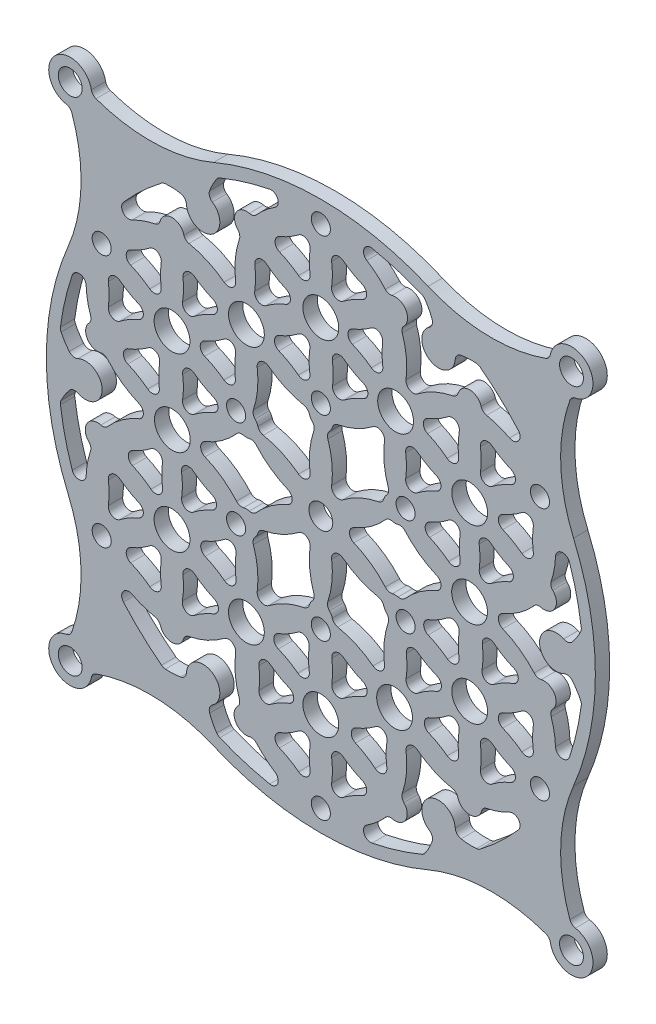
from build123d import *

# Parameters (mm, degrees)
ESBO_O1_W                = 120
ESBO_O1_H                = 120
RESSALTO_EXTRUS_O1_DEPTH = 3
ESBO_O2_R                = 2.5
CORTE_EXTRUS_O1_DEPTH    = 85.905830189
ESBO_O3_W                = 120
ESBO_O3_H                = 120
ESBO_O3_R                = 2.5
ESBO_O3_R_2              = 3.75
CORTE_EXTRUS_O2_DEPTH    = 85.905830189
ESBO_O4_R                = 2
CORTE_EXTRUS_O3_DEPTH    = 10


with BuildPart() as part:
    # Esboço1 → Ressalto-extrusão1 (new body)
    with BuildSketch(Plane.XY):
        Rectangle(ESBO_O1_W, ESBO_O1_H)
    extrude(amount=RESSALTO_EXTRUS_O1_DEPTH)

    # Esboço2 → Corte-extrusão1 (cut, through all)
    with BuildSketch(Plane.XY.offset(3)):
        with Locations((-52.5, 52.5)):
            Circle(ESBO_O2_R)
        with Locations((52.5, 52.5)):
            Circle(ESBO_O2_R)
        with Locations((52.5, -52.5)):
            Circle(ESBO_O2_R)
        with Locations((-52.5, -52.5)):
            Circle(ESBO_O2_R)
    extrude(amount=-CORTE_EXTRUS_O1_DEPTH, mode=Mode.SUBTRACT)

    # Esboço3 → Corte-extrusão2 (cut, through all)
    # profile 1 of 62: a face of its own
    with BuildSketch(Plane.XY.offset(3)):
        Rectangle(ESBO_O3_W, ESBO_O3_H)
        with BuildLine():
            ThreePointArc((52.926828817, 22.472222662), (57.5, 0), (52.926828817, -22.472222662))
            ThreePointArc((52.926828817, -22.472222662), (50.238285109, -34.713933242), (52.16675505, -47.098146938))
            ThreePointArc((52.16675505, -47.098146938), (52.6077104, -47.739558715), (53.310735171, -48.073634845))
            ThreePointArc((53.310735171, -48.073634845), (55.681980515, -55.681980515), (48.073634845, -53.310735171))
            ThreePointArc((48.073634845, -53.310735171), (47.739558715, -52.6077104), (47.098146938, -52.16675505))
            ThreePointArc((47.098146938, -52.16675505), (34.713933242, -50.238285109), (22.472222662, -52.926828817))
            ThreePointArc((22.472222662, -52.926828817), (0, -57.5), (-22.472222662, -52.926828817))
            ThreePointArc((-22.472222662, -52.926828817), (-34.713933242, -50.238285109), (-47.098146938, -52.16675505))
            ThreePointArc((-47.098146938, -52.16675505), (-47.739558715, -52.6077104), (-48.073634845, -53.310735171))
            ThreePointArc((-48.073634845, -53.310735171), (-55.681980515, -55.681980515), (-53.310735171, -48.073634845))
            ThreePointArc((-53.310735171, -48.073634845), (-52.6077104, -47.739558715), (-52.16675505, -47.098146938))
            ThreePointArc((-52.16675505, -47.098146938), (-50.238285109, -34.713933242), (-52.926828817, -22.472222662))
            ThreePointArc((-52.926828817, -22.472222662), (-57.5, 0), (-52.926828817, 22.472222662))
            ThreePointArc((-52.926828817, 22.472222662), (-50.238285109, 34.713933242), (-52.16675505, 47.098146938))
            ThreePointArc((-52.16675505, 47.098146938), (-52.6077104, 47.739558715), (-53.310735171, 48.073634845))
            ThreePointArc((-53.310735171, 48.073634845), (-55.681980515, 55.681980515), (-48.073634845, 53.310735171))
            ThreePointArc((-48.073634845, 53.310735171), (-47.739558715, 52.6077104), (-47.098146938, 52.16675505))
            ThreePointArc((-47.098146938, 52.16675505), (-34.713933242, 50.238285109), (-22.472222662, 52.926828817))
            ThreePointArc((-22.472222662, 52.926828817), (0, 57.5), (22.472222662, 52.926828817))
            ThreePointArc((22.472222662, 52.926828817), (34.713933242, 50.238285109), (47.098146938, 52.16675505))
            ThreePointArc((47.098146938, 52.16675505), (47.739558715, 52.6077104), (48.073634845, 53.310735171))
            ThreePointArc((48.073634845, 53.310735171), (55.681980515, 55.681980515), (53.310735171, 48.073634845))
            ThreePointArc((53.310735171, 48.073634845), (52.6077104, 47.739558715), (52.16675505, 47.098146938))
            ThreePointArc((52.16675505, 47.098146938), (50.238285109, 34.713933242), (52.926828817, 22.472222662))
        make_face(mode=Mode.SUBTRACT)
    # profile 2 of 62: a face of its own
    with BuildSketch(Plane.XY.offset(3)):
        Circle(ESBO_O3_R)
    # profile 3 of 62: a face of its own
    with BuildSketch(Plane.XY.offset(3)):
        with BuildLine():
            ThreePointArc((2.400354122, 17.301215278), (2.165063509, 16.75), (1.805342382, 16.270624713))
            ThreePointArc((1.805342382, 16.270624713), (1.424466196, 15.559289323), (1.467239729, 14.753538038))
            ThreePointArc((1.467239729, 14.753538038), (2.324697126, 10.766040666), (2.262426364, 6.68786818))
            ThreePointArc((2.262426364, 6.68786818), (3, 5.196152423), (4.660650559, 5.303252795))
            ThreePointArc((4.660650559, 5.303252795), (8.161316152, 7.396267101), (12.043318872, 8.647435897))
            ThreePointArc((12.043318872, 8.647435897), (12.76250672, 9.013268574), (13.188103146, 9.698784722))
            ThreePointArc((13.188103146, 9.698784722), (13.423393759, 10.25), (13.783114886, 10.729375287))
            ThreePointArc((13.783114886, 10.729375287), (14.163991072, 11.440710678), (14.121217539, 12.246461962))
            ThreePointArc((14.121217539, 12.246461962), (13.263760142, 16.233959334), (13.326030904, 20.31213182))
            ThreePointArc((13.326030904, 20.31213182), (12.588457268, 21.803847577), (10.927806709, 21.696747205))
            ThreePointArc((10.927806709, 21.696747205), (7.427141116, 19.603732899), (3.545138396, 18.352564103))
            ThreePointArc((3.545138396, 18.352564103), (2.825950548, 17.986731427), (2.400354122, 17.301215278))
        make_face()
    # profile 4 of 62: a face of its own
    with BuildSketch(Plane.XY.offset(3)):
        with BuildLine():
            ThreePointArc((9.633487233, -51.205128205), (9.043577777, -53.029345679), (10.728883756, -53.943406023))
            ThreePointArc((10.728883756, -53.943406023), (16.030662641, -52.611955441), (21.174087089, -50.76079231))
            ThreePointArc((21.174087089, -50.76079231), (21.547627608, -50.536393827), (21.840907819, -50.214099062))
            ThreePointArc((21.840907819, -50.214099062), (22.649446887, -48.847767429), (23.293856244, -47.396790469))
            ThreePointArc((23.293856244, -47.396790469), (23.317183811, -46.407389134), (22.719186733, -45.618808972))
            ThreePointArc((22.719186733, -45.618808972), (22.900415707, -39.673479264), (28.146896296, -42.47601931))
            ThreePointArc((28.146896296, -42.47601931), (28.525843263, -43.379148452), (29.381390361, -43.855889697))
            ThreePointArc((29.381390361, -43.855889697), (30.983933174, -44.03593585), (32.596352323, -44.01015656))
            ThreePointArc((32.596352323, -44.01015656), (33.013599121, -43.915526886), (33.387158074, -43.706952259))
            ThreePointArc((33.387158074, -43.706952259), (37.554424243, -40.182897105), (41.351918104, -36.263188899))
            ThreePointArc((41.351918104, -36.263188899), (41.402971616, -34.346640935), (39.528198213, -33.945408773))
            ThreePointArc((39.528198213, -33.945408773), (37.185694663, -34.967455949), (34.722052932, -35.647435897))
            ThreePointArc((34.722052932, -35.647435897), (34.05606544, -35.993062969), (33.675990789, -36.640010163))
            ThreePointArc((33.675990789, -36.640010163), (31.176914536, -38.579727723), (28.677838283, -36.640010163))
            ThreePointArc((28.677838283, -36.640010163), (28.297763632, -35.993062969), (27.63177614, -35.647435897))
            ThreePointArc((27.63177614, -35.647435897), (23.74977342, -34.396267101), (20.249107827, -32.303252795))
            ThreePointArc((20.249107827, -32.303252795), (18.588457268, -32.196152423), (17.850883632, -33.68786818))
            ThreePointArc((17.850883632, -33.68786818), (17.913154395, -37.766040666), (17.055696997, -41.753538038))
            ThreePointArc((17.055696997, -41.753538038), (17.012923464, -42.559289322), (17.39379965, -43.270624713))
            ThreePointArc((17.39379965, -43.270624713), (17.753520778, -46.25), (14.993445528, -47.428160009))
            ThreePointArc((14.993445528, -47.428160009), (14.186972916, -47.453979251), (13.510558601, -47.893897859))
            ThreePointArc((13.510558601, -47.893897859), (11.689857826, -49.68748421), (9.633487233, -51.205128205))
        make_face()
    # profile 5 of 62: a face of its own
    with BuildSketch(Plane.XY.offset(3)):
        with Locations((0, 36)):
            Circle(ESBO_O3_R_2)
    # profile 6 of 62: a face of its own
    with BuildSketch(Plane.XY.offset(3)):
        with BuildLine():
            ThreePointArc((21.815737444, 50.234347462), (21.525162343, 50.548378952), (21.157751941, 50.767603182))
            ThreePointArc((21.157751941, 50.767603182), (16.022197569, 52.614533972), (10.728883756, 53.943406023))
            ThreePointArc((10.728883756, 53.943406023), (9.043577777, 53.029345679), (9.633487233, 51.205128205))
            ThreePointArc((9.633487233, 51.205128205), (11.689857826, 49.68748421), (13.510558601, 47.893897859))
            ThreePointArc((13.510558601, 47.893897859), (14.142874171, 47.489949309), (14.893184201, 47.484268602))
            ThreePointArc((14.893184201, 47.484268602), (17.822567011, 46.289863862), (17.392260454, 43.15574156))
            ThreePointArc((17.392260454, 43.15574156), (17.022025075, 42.50311366), (17.055696997, 41.753538038))
            ThreePointArc((17.055696997, 41.753538038), (17.913154395, 37.766040666), (17.850883632, 33.68786818))
            ThreePointArc((17.850883632, 33.68786818), (18.588457268, 32.196152423), (20.249107827, 32.303252795))
            ThreePointArc((20.249107827, 32.303252795), (23.74977342, 34.396267101), (27.63177614, 35.647435897))
            ThreePointArc((27.63177614, 35.647435897), (28.350963988, 36.013268573), (28.776560414, 36.698784722))
            ThreePointArc((28.776560414, 36.698784722), (31.176914536, 38.5), (33.577268658, 36.698784722))
            ThreePointArc((33.577268658, 36.698784722), (34.002865084, 36.013268573), (34.722052932, 35.647435897))
            ThreePointArc((34.722052932, 35.647435897), (37.185694663, 34.967455949), (39.528198213, 33.945408773))
            ThreePointArc((39.528198213, 33.945408773), (41.402971616, 34.346640935), (41.351918104, 36.263188899))
            ThreePointArc((41.351918104, 36.263188899), (37.547958634, 40.188938807), (33.373092112, 43.717693476))
            ThreePointArc((33.373092112, 43.717693476), (32.991987066, 43.928989813), (32.566231506, 44.021830544))
            ThreePointArc((32.566231506, 44.021830544), (30.978684068, 44.0388801), (29.399896482, 43.871466494))
            ThreePointArc((29.399896482, 43.871466494), (28.531386008, 43.396968092), (28.147454094, 42.48479735))
            ThreePointArc((28.147454094, 42.48479735), (22.908033046, 39.669081391), (22.711863626, 45.613936885))
            ThreePointArc((22.711863626, 45.613936885), (23.304522923, 46.393679156), (23.289619403, 47.3729753))
            ThreePointArc((23.289619403, 47.3729753), (22.644272538, 48.850841163), (21.815737444, 50.234347462))
        make_face()
    # profile 7 of 62: a face of its own
    with BuildSketch(Plane.XY.offset(3)):
        with BuildLine():
            ThreePointArc((54.412089767, 6.224190903), (54.538761464, 6.632852067), (54.544910015, 7.060650923))
            ThreePointArc((54.544910015, 7.060650923), (53.576621812, 12.431636866), (52.080801861, 17.680217124))
            ThreePointArc((52.080801861, 17.680217124), (50.446549392, 18.682704744), (49.161685446, 17.259719432))
            ThreePointArc((49.161685446, 17.259719432), (48.875552489, 14.720028261), (48.232611533, 12.246461962))
            ThreePointArc((48.232611533, 12.246461962), (48.198939611, 11.49688634), (48.56917499, 10.84425844))
            ThreePointArc((48.56917499, 10.84425844), (48.999481547, 7.710136138), (46.070098738, 6.515731398))
            ThreePointArc((46.070098738, 6.515731398), (45.319788707, 6.510050691), (44.687473137, 6.106102141))
            ThreePointArc((44.687473137, 6.106102141), (41.662927815, 3.369773566), (38.099991459, 1.384615385))
            ThreePointArc((38.099991459, 1.384615385), (37.176914536, 0), (38.099991459, -1.384615385))
            ThreePointArc((38.099991459, -1.384615385), (41.662927815, -3.369773566), (44.687473137, -6.106102141))
            ThreePointArc((44.687473137, -6.106102141), (45.363887452, -6.546020749), (46.170360064, -6.571839991))
            ThreePointArc((46.170360064, -6.571839991), (48.930435314, -7.75), (48.570714187, -10.729375287))
            ThreePointArc((48.570714187, -10.729375287), (48.189838, -11.440710678), (48.232611533, -12.246461962))
            ThreePointArc((48.232611533, -12.246461962), (48.875552489, -14.720028261), (49.161685446, -17.259719432))
            ThreePointArc((49.161685446, -17.259719432), (50.446549392, -18.682704744), (52.080801861, -17.680217124))
            ThreePointArc((52.080801861, -17.680217124), (53.578621275, -12.423016634), (54.547179201, -7.043098834))
            ThreePointArc((54.547179201, -7.043098834), (54.539614674, -6.607404014), (54.407139325, -6.192268518))
            ThreePointArc((54.407139325, -6.192268518), (53.628130955, -4.808887328), (52.693752726, -3.525323975))
            ThreePointArc((52.693752726, -3.525323975), (51.848569819, -3.010421042), (50.866640827, -3.134011622))
            ThreePointArc((50.866640827, -3.134011622), (45.808448752, -0.004397873), (50.858759922, 3.137917575))
            ThreePointArc((50.858759922, 3.137917575), (51.830366186, 3.014530704), (52.671009764, 3.517085603))
            ThreePointArc((52.671009764, 3.517085603), (53.628205712, 4.814905313), (54.412089767, 6.224190903))
        make_face()
    # profile 8 of 62: a face of its own
    with BuildSketch(Plane.XY.offset(3)):
        with BuildLine():
            ThreePointArc((-2.262426305, 47.312135075), (-2.999999788, 48.803851036), (-4.660650466, 48.696750731))
            ThreePointArc((-4.660650466, 48.696750731), (-6.591521706, 47.409503238), (-8.671746356, 46.380943439))
            ThreePointArc((-8.671746356, 46.380943439), (-9.594822931, 44.995305167), (-8.669857412, 43.610927121))
            ThreePointArc((-8.669857412, 43.610927121), (-6.590050135, 42.58597826), (-4.659251221, 41.302181534))
            ThreePointArc((-4.659251221, 41.302181534), (-2.999237772, 41.196589212), (-2.262426305, 42.687864925))
            ThreePointArc((-2.262426305, 42.687864925), (-2.411543095, 45), (-2.262426305, 47.312135075))
        make_face()
    # profile 9 of 62: a face of its own
    with BuildSketch(Plane.XY.offset(3)):
        with BuildLine():
            ThreePointArc((-4.660650559, 5.303252795), (-3, 5.196152423), (-2.262426364, 6.68786818))
            ThreePointArc((-2.262426364, 6.68786818), (-2.324697126, 10.766040666), (-1.467239729, 14.753538038))
            ThreePointArc((-1.467239729, 14.753538038), (-1.424466196, 15.559289323), (-1.805342382, 16.270624713))
            ThreePointArc((-1.805342382, 16.270624713), (-2.165063509, 16.75), (-2.400354122, 17.301215278))
            ThreePointArc((-2.400354122, 17.301215278), (-2.825950548, 17.986731427), (-3.545138396, 18.352564103))
            ThreePointArc((-3.545138396, 18.352564103), (-7.427141116, 19.603732899), (-10.927806709, 21.696747205))
            ThreePointArc((-10.927806709, 21.696747205), (-12.588457268, 21.803847577), (-13.326030904, 20.31213182))
            ThreePointArc((-13.326030904, 20.31213182), (-13.263760142, 16.233959334), (-14.121217539, 12.246461962))
            ThreePointArc((-14.121217539, 12.246461962), (-14.163991072, 11.440710678), (-13.783114886, 10.729375287))
            ThreePointArc((-13.783114886, 10.729375287), (-13.423393759, 10.25), (-13.188103146, 9.698784722))
            ThreePointArc((-13.188103146, 9.698784722), (-12.76250672, 9.013268574), (-12.043318872, 8.647435897))
            ThreePointArc((-12.043318872, 8.647435897), (-8.161316152, 7.396267101), (-4.660650559, 5.303252795))
        make_face()
    # profile 10 of 62: a face of its own
    with BuildSketch(Plane.XY.offset(3)):
        with BuildLine():
            ThreePointArc((-11.386123178, 40.058830788), (-13.063816839, 40.208088268), (-13.822532993, 38.704331766))
            ThreePointArc((-13.822532993, 38.704331766), (-13.673407001, 36.280994404), (-13.851244531, 33.859594738))
            ThreePointArc((-13.851244531, 33.859594738), (-13.13108246, 32.358989819), (-11.468949032, 32.447086322))
            ThreePointArc((-11.468949032, 32.447086322), (-9.469712582, 33.742635157), (-7.317110265, 34.763270466))
            ThreePointArc((-7.317110265, 34.763270466), (-6.369072339, 36.129081592), (-7.263499326, 37.530586606))
            ThreePointArc((-7.263499326, 37.530586606), (-9.410106776, 38.655623491), (-11.386123178, 40.058830788))
        make_face()
    # profile 11 of 62: a face of its own
    with BuildSketch(Plane.XY.offset(3)):
        with BuildLine():
            ThreePointArc((-8.783415417, 28.364032231), (-9.713921143, 26.977781412), (-8.786072896, 25.58975048))
            ThreePointArc((-8.786072896, 25.58975048), (-6.665766027, 24.547714014), (-4.699589966, 23.237869397))
            ThreePointArc((-4.699589966, 23.237869397), (-3.03718165, 23.130653991), (-2.300934615, 24.624988912))
            ThreePointArc((-2.300934615, 24.624988912), (-2.455227922, 26.970730886), (-2.302991209, 29.31660723))
            ThreePointArc((-2.302991209, 29.31660723), (-3.038768983, 30.809267734), (-4.699596508, 30.704119057))
            ThreePointArc((-4.699596508, 30.704119057), (-6.664811567, 29.400231882), (-8.783415417, 28.364032231))
        make_face()
    # profile 12 of 62: a face of its own
    with BuildSketch(Plane.XY.offset(3)):
        with BuildLine():
            ThreePointArc((4.660650466, 48.696750731), (2.999999787, 48.803851036), (2.262426305, 47.312135075))
            ThreePointArc((2.262426305, 47.312135075), (2.411543094, 45), (2.262426306, 42.687864924))
            ThreePointArc((2.262426306, 42.687864924), (2.999237773, 41.196589212), (4.659251221, 41.302181534))
            ThreePointArc((4.659251221, 41.302181534), (6.590050135, 42.58597826), (8.669857412, 43.610927121))
            ThreePointArc((8.669857412, 43.610927121), (9.594822931, 44.995305167), (8.671746356, 46.380943439))
            ThreePointArc((8.671746356, 46.380943439), (6.591521706, 47.409503238), (4.660650466, 48.696750731))
        make_face()
    # profile 13 of 62: a face of its own
    with BuildSketch(Plane.XY.offset(3)):
        with BuildLine():
            ThreePointArc((2.460760777, 24.859368785), (3.199366057, 23.382968115), (4.847391682, 23.479447327))
            ThreePointArc((4.847391682, 23.479447327), (6.805199838, 24.752352555), (8.91086272, 25.762047719))
            ThreePointArc((8.91086272, 25.762047719), (9.851082266, 27.151559068), (8.914800635, 28.543726908))
            ThreePointArc((8.914800635, 28.543726908), (6.784667925, 29.577940794), (4.811072198, 30.886368717))
            ThreePointArc((4.811072198, 30.886368717), (3.144224652, 30.989472573), (2.41509594, 29.487013765))
            ThreePointArc((2.41509594, 29.487013765), (2.587032119, 27.174662607), (2.460760777, 24.859368785))
        make_face()
    # profile 14 of 62: a face of its own
    with BuildSketch(Plane.XY.offset(3)):
        with BuildLine():
            ThreePointArc((10.58809904, 32.204962577), (12.24773983, 32.103880625), (12.981025063, 33.59616675))
            ThreePointArc((12.981025063, 33.59616675), (12.827643734, 35.822067589), (12.950381392, 38.049868264))
            ThreePointArc((12.950381392, 38.049868264), (12.218611201, 39.51929982), (10.579041971, 39.438494808))
            ThreePointArc((10.579041971, 39.438494808), (8.667836021, 38.22602413), (6.619582131, 37.262982422))
            ThreePointArc((6.619582131, 37.262982422), (5.671243313, 35.877479518), (6.602177613, 34.48022287))
            ThreePointArc((6.602177613, 34.48022287), (8.668953546, 33.471906133), (10.58809904, 32.204962577))
        make_face()
    # profile 15 of 62: a face of its own
    with BuildSketch(Plane.XY.offset(3)):
        with BuildLine():
            ThreePointArc((16.183469008, 6.571839991), (15.588457268, 6.5), (14.993445528, 6.571839991))
            ThreePointArc((14.993445528, 6.571839991), (14.186972916, 6.546020749), (13.510558601, 6.106102141))
            ThreePointArc((13.510558601, 6.106102141), (10.486013279, 3.369773566), (6.923076923, 1.384615385))
            ThreePointArc((6.923076923, 1.384615385), (6, 0), (6.923076923, -1.384615385))
            ThreePointArc((6.923076923, -1.384615385), (10.486013279, -3.369773566), (13.510558601, -6.106102141))
            ThreePointArc((13.510558601, -6.106102141), (14.186972916, -6.546020749), (14.993445528, -6.571839991))
            ThreePointArc((14.993445528, -6.571839991), (15.588457268, -6.5), (16.183469008, -6.571839991))
            ThreePointArc((16.183469008, -6.571839991), (16.98994162, -6.546020749), (17.666355935, -6.106102141))
            ThreePointArc((17.666355935, -6.106102141), (20.690901258, -3.369773566), (24.253837613, -1.384615385))
            ThreePointArc((24.253837613, -1.384615385), (25.176914536, 0), (24.253837613, 1.384615385))
            ThreePointArc((24.253837613, 1.384615385), (20.690901258, 3.369773566), (17.666355935, 6.106102141))
            ThreePointArc((17.666355935, 6.106102141), (16.98994162, 6.546020749), (16.183469008, 6.571839991))
        make_face()
    # profile 16 of 62: a face of its own
    with BuildSketch(Plane.XY.offset(3)):
        with BuildLine():
            ThreePointArc((-39.528198213, -33.945408773), (-41.402971616, -34.346640935), (-41.351918104, -36.263188899))
            ThreePointArc((-41.351918104, -36.263188899), (-37.547958634, -40.188938807), (-33.373092112, -43.717693476))
            ThreePointArc((-33.373092112, -43.717693476), (-32.991987066, -43.928989813), (-32.566231506, -44.021830544))
            ThreePointArc((-32.566231506, -44.021830544), (-30.978684068, -44.0388801), (-29.399896482, -43.871466494))
            ThreePointArc((-29.399896482, -43.871466494), (-28.531386008, -43.396968092), (-28.147454094, -42.48479735))
            ThreePointArc((-28.147454094, -42.48479735), (-22.908033046, -39.669081391), (-22.711863626, -45.613936885))
            ThreePointArc((-22.711863626, -45.613936885), (-23.304522923, -46.393679156), (-23.289619403, -47.3729753))
            ThreePointArc((-23.289619403, -47.3729753), (-22.644272538, -48.850841163), (-21.815737444, -50.234347462))
            ThreePointArc((-21.815737444, -50.234347462), (-21.525162343, -50.548378952), (-21.157751941, -50.767603182))
            ThreePointArc((-21.157751941, -50.767603182), (-16.022197569, -52.614533972), (-10.728883756, -53.943406023))
            ThreePointArc((-10.728883756, -53.943406023), (-9.043577777, -53.029345679), (-9.633487233, -51.205128205))
            ThreePointArc((-9.633487233, -51.205128205), (-11.689857826, -49.68748421), (-13.510558601, -47.893897859))
            ThreePointArc((-13.510558601, -47.893897859), (-14.142874171, -47.489949309), (-14.893184201, -47.484268602))
            ThreePointArc((-14.893184201, -47.484268602), (-17.822567011, -46.289863862), (-17.392260454, -43.15574156))
            ThreePointArc((-17.392260454, -43.15574156), (-17.022025075, -42.50311366), (-17.055696997, -41.753538038))
            ThreePointArc((-17.055696997, -41.753538038), (-17.913154395, -37.766040666), (-17.850883632, -33.68786818))
            ThreePointArc((-17.850883632, -33.68786818), (-18.588457268, -32.196152423), (-20.249107827, -32.303252795))
            ThreePointArc((-20.249107827, -32.303252795), (-23.74977342, -34.396267101), (-27.63177614, -35.647435897))
            ThreePointArc((-27.63177614, -35.647435897), (-28.350963988, -36.013268573), (-28.776560414, -36.698784722))
            ThreePointArc((-28.776560414, -36.698784722), (-31.176914536, -38.5), (-33.577268658, -36.698784722))
            ThreePointArc((-33.577268658, -36.698784722), (-34.002865084, -36.013268573), (-34.722052932, -35.647435897))
            ThreePointArc((-34.722052932, -35.647435897), (-37.185694663, -34.967455949), (-39.528198213, -33.945408773))
        make_face()
    # profile 17 of 62: a face of its own
    with BuildSketch(Plane.XY.offset(3)):
        with Locations((31.176914536, 18)):
            Circle(ESBO_O3_R_2)
    # profile 18 of 62: a face of its own
    with BuildSketch(Plane.XY.offset(3)):
        with BuildLine():
            ThreePointArc((-17.850883632, 33.68786818), (-17.913154395, 37.766040666), (-17.055696997, 41.753538038))
            ThreePointArc((-17.055696997, 41.753538038), (-17.012923464, 42.559289322), (-17.39379965, 43.270624713))
            ThreePointArc((-17.39379965, 43.270624713), (-17.753520778, 46.25), (-14.993445528, 47.428160009))
            ThreePointArc((-14.993445528, 47.428160009), (-14.186972916, 47.453979251), (-13.510558601, 47.893897859))
            ThreePointArc((-13.510558601, 47.893897859), (-11.689857826, 49.68748421), (-9.633487233, 51.205128205))
            ThreePointArc((-9.633487233, 51.205128205), (-9.043577777, 53.029345679), (-10.728883756, 53.943406023))
            ThreePointArc((-10.728883756, 53.943406023), (-16.030662641, 52.611955441), (-21.174087089, 50.76079231))
            ThreePointArc((-21.174087089, 50.76079231), (-21.547627608, 50.536393827), (-21.840907819, 50.214099062))
            ThreePointArc((-21.840907819, 50.214099062), (-22.649446887, 48.847767429), (-23.293856244, 47.396790469))
            ThreePointArc((-23.293856244, 47.396790469), (-23.317183811, 46.407389134), (-22.719186733, 45.618808972))
            ThreePointArc((-22.719186733, 45.618808972), (-22.900415707, 39.673479264), (-28.146896296, 42.47601931))
            ThreePointArc((-28.146896296, 42.47601931), (-28.525843263, 43.379148452), (-29.381390361, 43.855889697))
            ThreePointArc((-29.381390361, 43.855889697), (-30.983933174, 44.03593585), (-32.596352323, 44.01015656))
            ThreePointArc((-32.596352323, 44.01015656), (-33.013599121, 43.915526886), (-33.387158074, 43.706952259))
            ThreePointArc((-33.387158074, 43.706952259), (-37.554424243, 40.182897105), (-41.351918104, 36.263188899))
            ThreePointArc((-41.351918104, 36.263188899), (-41.402971616, 34.346640935), (-39.528198213, 33.945408773))
            ThreePointArc((-39.528198213, 33.945408773), (-37.185694663, 34.967455949), (-34.722052932, 35.647435897))
            ThreePointArc((-34.722052932, 35.647435897), (-34.05606544, 35.993062969), (-33.675990789, 36.640010163))
            ThreePointArc((-33.675990789, 36.640010163), (-31.176914536, 38.579727723), (-28.677838283, 36.640010163))
            ThreePointArc((-28.677838283, 36.640010163), (-28.297763632, 35.993062969), (-27.63177614, 35.647435897))
            ThreePointArc((-27.63177614, 35.647435897), (-23.74977342, 34.396267101), (-20.249107827, 32.303252795))
            ThreePointArc((-20.249107827, 32.303252795), (-18.588457268, 32.196152423), (-17.850883632, 33.68786818))
        make_face()
    # profile 19 of 62: a face of its own
    with BuildSketch(Plane.XY.offset(3)):
        with BuildLine():
            ThreePointArc((-54.412089767, -6.224190903), (-54.538761464, -6.632852067), (-54.544910015, -7.060650923))
            ThreePointArc((-54.544910015, -7.060650923), (-53.576621812, -12.431636866), (-52.080801861, -17.680217124))
            ThreePointArc((-52.080801861, -17.680217124), (-50.446549392, -18.682704744), (-49.161685446, -17.259719432))
            ThreePointArc((-49.161685446, -17.259719432), (-48.875552489, -14.720028261), (-48.232611533, -12.246461962))
            ThreePointArc((-48.232611533, -12.246461962), (-48.198939611, -11.49688634), (-48.56917499, -10.84425844))
            ThreePointArc((-48.56917499, -10.84425844), (-48.999481547, -7.710136138), (-46.070098738, -6.515731398))
            ThreePointArc((-46.070098738, -6.515731398), (-45.319788707, -6.510050691), (-44.687473137, -6.106102141))
            ThreePointArc((-44.687473137, -6.106102141), (-41.662927815, -3.369773566), (-38.099991459, -1.384615385))
            ThreePointArc((-38.099991459, -1.384615385), (-37.176914536, 0), (-38.099991459, 1.384615385))
            ThreePointArc((-38.099991459, 1.384615385), (-41.662927815, 3.369773566), (-44.687473137, 6.106102141))
            ThreePointArc((-44.687473137, 6.106102141), (-45.363887452, 6.546020749), (-46.170360064, 6.571839991))
            ThreePointArc((-46.170360064, 6.571839991), (-48.930435314, 7.75), (-48.570714187, 10.729375287))
            ThreePointArc((-48.570714187, 10.729375287), (-48.189838, 11.440710678), (-48.232611533, 12.246461962))
            ThreePointArc((-48.232611533, 12.246461962), (-48.875552489, 14.720028261), (-49.161685446, 17.259719432))
            ThreePointArc((-49.161685446, 17.259719432), (-50.446549392, 18.682704744), (-52.080801861, 17.680217124))
            ThreePointArc((-52.080801861, 17.680217124), (-53.578621275, 12.423016634), (-54.547179201, 7.043098834))
            ThreePointArc((-54.547179201, 7.043098834), (-54.539614674, 6.607404014), (-54.407139325, 6.192268518))
            ThreePointArc((-54.407139325, 6.192268518), (-53.628130955, 4.808887328), (-52.693752726, 3.525323975))
            ThreePointArc((-52.693752726, 3.525323975), (-51.848569819, 3.010421042), (-50.866640827, 3.134011622))
            ThreePointArc((-50.866640827, 3.134011622), (-45.808448752, 0.004397873), (-50.858759922, -3.137917575))
            ThreePointArc((-50.858759922, -3.137917575), (-51.830366186, -3.014530704), (-52.671009764, -3.517085603))
            ThreePointArc((-52.671009764, -3.517085603), (-53.628205712, -4.814905313), (-54.412089767, -6.224190903))
        make_face()
    # profile 20 of 62: a face of its own
    with BuildSketch(Plane.XY.offset(3)):
        with BuildLine():
            ThreePointArc((39.84229773, 25.615386192), (40.765374906, 27.000001546), (39.842297982, 28.384617067))
            ThreePointArc((39.842297982, 28.384617067), (37.762073332, 29.413176866), (35.831202092, 30.700424359))
            ThreePointArc((35.831202092, 30.700424359), (34.16966586, 30.807012986), (33.433242064, 29.313780326))
            ThreePointArc((33.433242064, 29.313780326), (33.58551395, 27.000139959), (33.439112829, 24.686120687))
            ThreePointArc((33.439112829, 24.686120687), (34.17767392, 23.195710709), (35.837562305, 23.303251117))
            ThreePointArc((35.837562305, 23.303251117), (37.765371623, 24.588457582), (39.84229773, 25.615386192))
        make_face()
    # profile 21 of 62: a face of its own
    with BuildSketch(Plane.XY.offset(3)):
        with BuildLine():
            ThreePointArc((28.99890352, 29.890087317), (28.289317458, 31.417641387), (26.60766805, 31.322830599))
            ThreePointArc((26.60766805, 31.322830599), (24.583559328, 29.982015021), (22.397646939, 28.925327006))
            ThreePointArc((22.397646939, 28.925327006), (21.458165994, 27.5513459), (22.365526517, 26.155944377))
            ThreePointArc((22.365526517, 26.155944377), (24.487122946, 25.072329241), (26.44732021, 23.718438604))
            ThreePointArc((26.44732021, 23.718438604), (28.104166304, 23.58031924), (28.870691757, 25.05566824))
            ThreePointArc((28.870691757, 25.05566824), (28.771698554, 27.477203266), (28.99890352, 29.890087317))
        make_face()
    # profile 22 of 62: a face of its own
    with BuildSketch(Plane.XY.offset(3)):
        with BuildLine():
            ThreePointArc((20.172264757, 21.788676999), (18.506483469, 21.901393186), (17.768337544, 20.403837568))
            ThreePointArc((17.768337544, 20.403837568), (17.926060927, 18.046579722), (17.774790245, 15.688898997))
            ThreePointArc((17.774790245, 15.688898997), (18.513143137, 14.19560346), (20.175398658, 14.305162285))
            ThreePointArc((20.175398658, 14.305162285), (22.129724145, 15.611655196), (24.237431009, 16.652752507))
            ThreePointArc((24.237431009, 16.652752507), (25.162224038, 18.036285003), (24.24074885, 19.422029492))
            ThreePointArc((24.24074885, 19.422029492), (22.128941904, 20.47201207), (20.172264757, 21.788676999))
        make_face()
    # profile 23 of 62: a face of its own
    with BuildSketch(Plane.XY.offset(3)):
        with BuildLine():
            ThreePointArc((44.502948448, 20.312133664), (43.765374694, 21.803849491), (42.104724035, 21.696748883))
            ThreePointArc((42.104724035, 21.696748883), (40.176914718, 20.411542418), (38.099988611, 19.384613807))
            ThreePointArc((38.099988611, 19.384613807), (37.176911693, 18.000878503), (38.09836405, 16.616060847))
            ThreePointArc((38.09836405, 16.616060847), (40.175564085, 15.585838301), (42.103099475, 14.297146795))
            ThreePointArc((42.103099475, 14.297146795), (43.764488791, 14.188292181), (44.502948448, 15.68051908))
            ThreePointArc((44.502948448, 15.68051908), (44.353595038, 17.996326372), (44.502948448, 20.312133664))
        make_face()
    # profile 24 of 62: a face of its own
    with BuildSketch(Plane.XY.offset(3)):
        with Locations((-15.588457268, 27)):
            Circle(ESBO_O3_R_2)
    # profile 25 of 62: a face of its own
    with BuildSketch(Plane.XY.offset(3)):
        with BuildLine():
            ThreePointArc((22.759225278, 10.298603047), (21.849927432, 8.920751776), (22.757493693, 7.541759325))
            ThreePointArc((22.757493693, 7.541759325), (24.838766035, 6.48270034), (26.766019138, 5.163990374))
            ThreePointArc((26.766019138, 5.163990374), (28.439481038, 5.044492037), (29.176992938, 6.551419635))
            ThreePointArc((29.176992938, 6.551419635), (29.007582082, 8.913275617), (29.153916038, 11.276673615))
            ThreePointArc((29.153916038, 11.276673615), (28.409782824, 12.771757863), (26.744050973, 12.651972446))
            ThreePointArc((26.744050973, 12.651972446), (24.827464216, 11.346895768), (22.759225278, 10.298603047))
        make_face()
    # profile 26 of 62: a face of its own
    with BuildSketch(Plane.XY.offset(3)):
        with BuildLine():
            ThreePointArc((33.18436524, 6.932918542), (33.926646096, 5.445086481), (35.585646406, 5.556185903))
            ThreePointArc((35.585646406, 5.556185903), (37.436642415, 6.801968451), (39.427343223, 7.809574858))
            ThreePointArc((39.427343223, 7.809574858), (40.334023184, 9.178022211), (39.444259376, 10.55752831))
            ThreePointArc((39.444259376, 10.55752831), (37.438625993, 11.606445875), (35.580480464, 12.898764923))
            ThreePointArc((35.580480464, 12.898764923), (33.906430343, 13.027298979), (33.16183774, 11.522457901))
            ThreePointArc((33.16183774, 11.522457901), (33.321997797, 9.228419071), (33.18436524, 6.932918542))
        make_face()
    # profile 27 of 62: a face of its own
    with BuildSketch(Plane.XY.offset(3)):
        with Locations((-31.100238718, 0.12634218)):
            Circle(ESBO_O3_R_2)
    # profile 28 of 62: a face of its own
    with BuildSketch(Plane.XY.offset(3)):
        with Locations((-15.588457268, -27)):
            Circle(ESBO_O3_R_2)
    # profile 29 of 62: a face of its own
    with BuildSketch(Plane.XY.offset(3)):
        with BuildLine():
            ThreePointArc((13.783114886, -10.729375287), (13.423393759, -10.25), (13.188103146, -9.698784722))
            ThreePointArc((13.188103146, -9.698784722), (12.76250672, -9.013268574), (12.043318872, -8.647435897))
            ThreePointArc((12.043318872, -8.647435897), (8.161316152, -7.396267101), (4.660650559, -5.303252795))
            ThreePointArc((4.660650559, -5.303252795), (3, -5.196152423), (2.262426364, -6.68786818))
            ThreePointArc((2.262426364, -6.68786818), (2.324697126, -10.766040666), (1.467239729, -14.753538038))
            ThreePointArc((1.467239729, -14.753538038), (1.424466196, -15.559289323), (1.805342382, -16.270624713))
            ThreePointArc((1.805342382, -16.270624713), (2.165063509, -16.75), (2.400354122, -17.301215278))
            ThreePointArc((2.400354122, -17.301215278), (2.825950548, -17.986731427), (3.545138396, -18.352564103))
            ThreePointArc((3.545138396, -18.352564103), (7.427141116, -19.603732899), (10.927806709, -21.696747205))
            ThreePointArc((10.927806709, -21.696747205), (12.588457268, -21.803847577), (13.326030904, -20.31213182))
            ThreePointArc((13.326030904, -20.31213182), (13.263760142, -16.233959334), (14.121217539, -12.246461962))
            ThreePointArc((14.121217539, -12.246461962), (14.163991072, -11.440710678), (13.783114886, -10.729375287))
        make_face()
    # profile 30 of 62: a face of its own
    with BuildSketch(Plane.XY.offset(3)):
        with Locations((31.176914536, -18)):
            Circle(ESBO_O3_R_2)
    # profile 31 of 62: a face of its own
    with BuildSketch(Plane.XY.offset(3)):
        with BuildLine():
            ThreePointArc((42.104724035, -21.696748883), (43.765374694, -21.803849491), (44.502948448, -20.312133664))
            ThreePointArc((44.502948448, -20.312133664), (44.353595038, -17.996326372), (44.502948448, -15.68051908))
            ThreePointArc((44.502948448, -15.68051908), (43.764488791, -14.18829218), (42.103099475, -14.297146795))
            ThreePointArc((42.103099475, -14.297146795), (40.175564085, -15.585838301), (38.09836405, -16.616060846))
            ThreePointArc((38.09836405, -16.616060846), (37.176911693, -18.000878503), (38.09998861, -19.384613808))
            ThreePointArc((38.09998861, -19.384613808), (40.176914718, -20.411542418), (42.104724035, -21.696748883))
        make_face()
    # profile 32 of 62: a face of its own
    with BuildSketch(Plane.XY.offset(3)):
        with BuildLine():
            ThreePointArc((40.385026697, -10.168743472), (41.353134297, -8.790446881), (40.430201042, -7.381501167))
            ThreePointArc((40.430201042, -7.381501167), (38.256966329, -6.298979383), (36.24889147, -4.934267731))
            ThreePointArc((36.24889147, -4.934267731), (34.589248455, -4.80764392), (33.834475549, -6.291141944))
            ThreePointArc((33.834475549, -6.291141944), (33.956835528, -8.670305916), (33.764430474, -11.044831861))
            ThreePointArc((33.764430474, -11.044831861), (34.473238644, -12.548762351), (36.134191083, -12.474918366))
            ThreePointArc((36.134191083, -12.474918366), (38.18180533, -11.178420225), (40.385026697, -10.168743472))
        make_face()
    # profile 33 of 62: a face of its own
    with BuildSketch(Plane.XY.offset(3)):
        with BuildLine():
            ThreePointArc((28.955680174, -6.575355232), (28.220404612, -5.076388226), (26.55441044, -5.185912912))
            ThreePointArc((26.55441044, -5.185912912), (24.591826954, -6.501134292), (22.474380211, -7.5489704))
            ThreePointArc((22.474380211, -7.5489704), (21.550324787, -8.935050531), (22.476333273, -10.319826627))
            ThreePointArc((22.476333273, -10.319826627), (24.584952067, -11.359075691), (26.540422218, -12.663854723))
            ThreePointArc((26.540422218, -12.663854723), (28.200993021, -12.772982731), (28.940345358, -11.282089564))
            ThreePointArc((28.940345358, -11.282089564), (28.793753471, -8.928219812), (28.955680174, -6.575355232))
        make_face()
    # profile 34 of 62: a face of its own
    with BuildSketch(Plane.XY.offset(3)):
        with BuildLine():
            ThreePointArc((39.842297982, -28.384617067), (40.765374906, -27.000001545), (39.84229773, -25.615386192))
            ThreePointArc((39.84229773, -25.615386192), (37.765371623, -24.588457582), (35.837562305, -23.303251117))
            ThreePointArc((35.837562305, -23.303251117), (34.177673921, -23.195710709), (33.439112829, -24.686120687))
            ThreePointArc((33.439112829, -24.686120687), (33.585513951, -27.000139959), (33.433242064, -29.313780326))
            ThreePointArc((33.433242064, -29.313780326), (34.16966586, -30.807012986), (35.831202092, -30.700424359))
            ThreePointArc((35.831202092, -30.700424359), (37.762073332, -29.413176866), (39.842297982, -28.384617067))
        make_face()
    # profile 35 of 62: a face of its own
    with BuildSketch(Plane.XY.offset(3)):
        with BuildLine():
            ThreePointArc((20.298464502, -14.560765738), (18.650561375, -14.462216339), (17.910102011, -15.937688002))
            ThreePointArc((17.910102011, -15.937688002), (18.033566197, -18.269652215), (17.855156418, -20.598057344))
            ThreePointArc((17.855156418, -20.598057344), (18.588398773, -22.107067031), (20.262192303, -21.992307273))
            ThreePointArc((20.262192303, -21.992307273), (22.222914157, -20.664665177), (24.34284384, -19.609695102))
            ThreePointArc((24.34284384, -19.609695102), (25.265558172, -18.21771471), (24.328955033, -16.835041319))
            ThreePointArc((24.328955033, -16.835041319), (22.240432097, -15.827766839), (20.298464502, -14.560765738))
        make_face()
    # profile 36 of 62: a face of its own
    with BuildSketch(Plane.XY.offset(3)):
        with BuildLine():
            ThreePointArc((22.5962662, -25.272044035), (21.678906266, -26.658794144), (22.604621344, -28.039980846))
            ThreePointArc((22.604621344, -28.039980846), (24.608998681, -29.020099138), (26.476961831, -30.240293406))
            ThreePointArc((26.476961831, -30.240293406), (28.115411983, -30.341277609), (28.865217406, -28.880966498))
            ThreePointArc((28.865217406, -28.880966498), (28.770789972, -26.619578255), (28.960898333, -24.364217499))
            ThreePointArc((28.960898333, -24.364217499), (28.23518703, -22.850180539), (26.559660127, -22.957764968))
            ThreePointArc((26.559660127, -22.957764968), (24.653044251, -24.243487062), (22.5962662, -25.272044035))
        make_face()
    # profile 37 of 62: a face of its own
    with BuildSketch(Plane.XY.offset(3)):
        with Locations((15.440703822, -26.996767884)):
            Circle(ESBO_O3_R_2)
    # profile 38 of 62: a face of its own
    with BuildSketch(Plane.XY.offset(3)):
        with Locations((31.150874238, 0.002370757)):
            Circle(ESBO_O3_R_2)
    # profile 39 of 62: a face of its own
    with BuildSketch(Plane.XY.offset(3)):
        with BuildLine():
            ThreePointArc((-2.400354122, -17.301215278), (-2.165063509, -16.75), (-1.805342382, -16.270624713))
            ThreePointArc((-1.805342382, -16.270624713), (-1.424466196, -15.559289323), (-1.467239729, -14.753538038))
            ThreePointArc((-1.467239729, -14.753538038), (-2.324697126, -10.766040666), (-2.262426364, -6.68786818))
            ThreePointArc((-2.262426364, -6.68786818), (-3, -5.196152423), (-4.660650559, -5.303252795))
            ThreePointArc((-4.660650559, -5.303252795), (-8.161316152, -7.396267101), (-12.043318872, -8.647435897))
            ThreePointArc((-12.043318872, -8.647435897), (-12.76250672, -9.013268574), (-13.188103146, -9.698784722))
            ThreePointArc((-13.188103146, -9.698784722), (-13.423393759, -10.25), (-13.783114886, -10.729375287))
            ThreePointArc((-13.783114886, -10.729375287), (-14.163991072, -11.440710678), (-14.121217539, -12.246461962))
            ThreePointArc((-14.121217539, -12.246461962), (-13.263760142, -16.233959334), (-13.326030904, -20.31213182))
            ThreePointArc((-13.326030904, -20.31213182), (-12.588457268, -21.803847577), (-10.927806709, -21.696747205))
            ThreePointArc((-10.927806709, -21.696747205), (-7.427141116, -19.603732899), (-3.545138396, -18.352564103))
            ThreePointArc((-3.545138396, -18.352564103), (-2.825950548, -17.986731427), (-2.400354122, -17.301215278))
        make_face()
    # profile 40 of 62: a face of its own
    with BuildSketch(Plane.XY.offset(3)):
        with Locations((0, -36)):
            Circle(ESBO_O3_R_2)
    # profile 41 of 62: a face of its own
    with BuildSketch(Plane.XY.offset(3)):
        with BuildLine():
            ThreePointArc((2.262426305, -47.312135075), (2.999999788, -48.803851036), (4.660650466, -48.696750731))
            ThreePointArc((4.660650466, -48.696750731), (6.591521706, -47.409503238), (8.671746356, -46.380943439))
            ThreePointArc((8.671746356, -46.380943439), (9.594822931, -44.995305167), (8.669857412, -43.610927121))
            ThreePointArc((8.669857412, -43.610927121), (6.590050135, -42.58597826), (4.659251221, -41.302181534))
            ThreePointArc((4.659251221, -41.302181534), (2.999237772, -41.196589212), (2.262426305, -42.687864925))
            ThreePointArc((2.262426305, -42.687864925), (2.411543095, -45), (2.262426305, -47.312135075))
        make_face()
    # profile 42 of 62: a face of its own
    with BuildSketch(Plane.XY.offset(3)):
        with BuildLine():
            ThreePointArc((11.386123178, -40.058830788), (13.063816839, -40.208088268), (13.822532993, -38.704331766))
            ThreePointArc((13.822532993, -38.704331766), (13.673407001, -36.280994404), (13.851244531, -33.859594738))
            ThreePointArc((13.851244531, -33.859594738), (13.13108246, -32.358989819), (11.468949032, -32.447086322))
            ThreePointArc((11.468949032, -32.447086322), (9.469712582, -33.742635157), (7.317110265, -34.763270466))
            ThreePointArc((7.317110265, -34.763270466), (6.369072339, -36.129081592), (7.263499326, -37.530586606))
            ThreePointArc((7.263499326, -37.530586606), (9.410106776, -38.655623491), (11.386123178, -40.058830788))
        make_face()
    # profile 43 of 62: a face of its own
    with BuildSketch(Plane.XY.offset(3)):
        with BuildLine():
            ThreePointArc((8.783415417, -28.364032231), (9.713921143, -26.977781412), (8.786072896, -25.58975048))
            ThreePointArc((8.786072896, -25.58975048), (6.665766027, -24.547714014), (4.699589966, -23.237869397))
            ThreePointArc((4.699589966, -23.237869397), (3.03718165, -23.130653991), (2.300934615, -24.624988912))
            ThreePointArc((2.300934615, -24.624988912), (2.455227922, -26.970730886), (2.302991209, -29.31660723))
            ThreePointArc((2.302991209, -29.31660723), (3.038768983, -30.809267734), (4.699596508, -30.704119057))
            ThreePointArc((4.699596508, -30.704119057), (6.664811567, -29.400231882), (8.783415417, -28.364032231))
        make_face()
    # profile 44 of 62: a face of its own
    with BuildSketch(Plane.XY.offset(3)):
        with BuildLine():
            ThreePointArc((-4.660650466, -48.696750731), (-2.999999787, -48.803851036), (-2.262426305, -47.312135075))
            ThreePointArc((-2.262426305, -47.312135075), (-2.411543094, -45), (-2.262426306, -42.687864924))
            ThreePointArc((-2.262426306, -42.687864924), (-2.999237773, -41.196589212), (-4.659251221, -41.302181534))
            ThreePointArc((-4.659251221, -41.302181534), (-6.590050135, -42.58597826), (-8.669857412, -43.610927121))
            ThreePointArc((-8.669857412, -43.610927121), (-9.594822931, -44.995305167), (-8.671746356, -46.380943439))
            ThreePointArc((-8.671746356, -46.380943439), (-6.591521706, -47.409503238), (-4.660650466, -48.696750731))
        make_face()
    # profile 45 of 62: a face of its own
    with BuildSketch(Plane.XY.offset(3)):
        with BuildLine():
            ThreePointArc((-2.460760777, -24.859368785), (-3.199366057, -23.382968115), (-4.847391682, -23.479447327))
            ThreePointArc((-4.847391682, -23.479447327), (-6.805199838, -24.752352555), (-8.91086272, -25.762047719))
            ThreePointArc((-8.91086272, -25.762047719), (-9.851082266, -27.151559068), (-8.914800635, -28.543726908))
            ThreePointArc((-8.914800635, -28.543726908), (-6.784667925, -29.577940794), (-4.811072198, -30.886368717))
            ThreePointArc((-4.811072198, -30.886368717), (-3.144224652, -30.989472573), (-2.41509594, -29.487013765))
            ThreePointArc((-2.41509594, -29.487013765), (-2.587032119, -27.174662607), (-2.460760777, -24.859368785))
        make_face()
    # profile 46 of 62: a face of its own
    with BuildSketch(Plane.XY.offset(3)):
        with BuildLine():
            ThreePointArc((-10.58809904, -32.204962577), (-12.24773983, -32.103880625), (-12.981025063, -33.59616675))
            ThreePointArc((-12.981025063, -33.59616675), (-12.827643734, -35.822067589), (-12.950381392, -38.049868264))
            ThreePointArc((-12.950381392, -38.049868264), (-12.218611201, -39.51929982), (-10.579041971, -39.438494808))
            ThreePointArc((-10.579041971, -39.438494808), (-8.667836021, -38.22602413), (-6.619582131, -37.262982422))
            ThreePointArc((-6.619582131, -37.262982422), (-5.671243313, -35.877479518), (-6.602177613, -34.48022287))
            ThreePointArc((-6.602177613, -34.48022287), (-8.668953546, -33.471906133), (-10.58809904, -32.204962577))
        make_face()
    # profile 47 of 62: a face of its own
    with BuildSketch(Plane.XY.offset(3)):
        with Locations((15.659534897, 26.870425704)):
            Circle(ESBO_O3_R_2)
    # profile 48 of 62: a face of its own
    with BuildSketch(Plane.XY.offset(3)):
        with BuildLine():
            ThreePointArc((-16.183469008, -6.571839991), (-15.588457268, -6.5), (-14.993445528, -6.571839991))
            ThreePointArc((-14.993445528, -6.571839991), (-14.186972916, -6.546020749), (-13.510558601, -6.106102141))
            ThreePointArc((-13.510558601, -6.106102141), (-10.486013279, -3.369773566), (-6.923076923, -1.384615385))
            ThreePointArc((-6.923076923, -1.384615385), (-6, 0), (-6.923076923, 1.384615385))
            ThreePointArc((-6.923076923, 1.384615385), (-10.486013279, 3.369773566), (-13.510558601, 6.106102141))
            ThreePointArc((-13.510558601, 6.106102141), (-14.186972916, 6.546020749), (-14.993445528, 6.571839991))
            ThreePointArc((-14.993445528, 6.571839991), (-15.588457268, 6.5), (-16.183469008, 6.571839991))
            ThreePointArc((-16.183469008, 6.571839991), (-16.98994162, 6.546020749), (-17.666355935, 6.106102141))
            ThreePointArc((-17.666355935, 6.106102141), (-20.690901258, 3.369773566), (-24.253837613, 1.384615385))
            ThreePointArc((-24.253837613, 1.384615385), (-25.176914536, 0), (-24.253837613, -1.384615385))
            ThreePointArc((-24.253837613, -1.384615385), (-20.690901258, -3.369773566), (-17.666355935, -6.106102141))
            ThreePointArc((-17.666355935, -6.106102141), (-16.98994162, -6.546020749), (-16.183469008, -6.571839991))
        make_face()
    # profile 49 of 62: a face of its own
    with BuildSketch(Plane.XY.offset(3)):
        with Locations((-31.176914536, -18)):
            Circle(ESBO_O3_R_2)
    # profile 50 of 62: a face of its own
    with BuildSketch(Plane.XY.offset(3)):
        with BuildLine():
            ThreePointArc((-39.84229773, -25.615386192), (-40.765374906, -27.000001546), (-39.842297982, -28.384617067))
            ThreePointArc((-39.842297982, -28.384617067), (-37.762073332, -29.413176866), (-35.831202092, -30.700424359))
            ThreePointArc((-35.831202092, -30.700424359), (-34.16966586, -30.807012986), (-33.433242064, -29.313780326))
            ThreePointArc((-33.433242064, -29.313780326), (-33.58551395, -27.000139959), (-33.439112829, -24.686120687))
            ThreePointArc((-33.439112829, -24.686120687), (-34.17767392, -23.195710709), (-35.837562305, -23.303251117))
            ThreePointArc((-35.837562305, -23.303251117), (-37.765371623, -24.588457582), (-39.84229773, -25.615386192))
        make_face()
    # profile 51 of 62: a face of its own
    with BuildSketch(Plane.XY.offset(3)):
        with BuildLine():
            ThreePointArc((-28.99890352, -29.890087317), (-28.289317458, -31.417641387), (-26.60766805, -31.322830599))
            ThreePointArc((-26.60766805, -31.322830599), (-24.583559328, -29.982015021), (-22.397646939, -28.925327006))
            ThreePointArc((-22.397646939, -28.925327006), (-21.458165994, -27.5513459), (-22.365526517, -26.155944377))
            ThreePointArc((-22.365526517, -26.155944377), (-24.487122946, -25.072329241), (-26.44732021, -23.718438604))
            ThreePointArc((-26.44732021, -23.718438604), (-28.104166304, -23.58031924), (-28.870691757, -25.05566824))
            ThreePointArc((-28.870691757, -25.05566824), (-28.771698554, -27.477203266), (-28.99890352, -29.890087317))
        make_face()
    # profile 52 of 62: a face of its own
    with BuildSketch(Plane.XY.offset(3)):
        with BuildLine():
            ThreePointArc((-20.172264757, -21.788676999), (-18.506483469, -21.901393186), (-17.768337544, -20.403837568))
            ThreePointArc((-17.768337544, -20.403837568), (-17.926060927, -18.046579722), (-17.774790245, -15.688898997))
            ThreePointArc((-17.774790245, -15.688898997), (-18.513143137, -14.19560346), (-20.175398658, -14.305162285))
            ThreePointArc((-20.175398658, -14.305162285), (-22.129724145, -15.611655196), (-24.237431009, -16.652752507))
            ThreePointArc((-24.237431009, -16.652752507), (-25.162224038, -18.036285003), (-24.24074885, -19.422029492))
            ThreePointArc((-24.24074885, -19.422029492), (-22.128941904, -20.47201207), (-20.172264757, -21.788676999))
        make_face()
    # profile 53 of 62: a face of its own
    with BuildSketch(Plane.XY.offset(3)):
        with BuildLine():
            ThreePointArc((-44.502948448, -20.312133664), (-43.765374694, -21.803849491), (-42.104724035, -21.696748883))
            ThreePointArc((-42.104724035, -21.696748883), (-40.176914718, -20.411542418), (-38.099988611, -19.384613807))
            ThreePointArc((-38.099988611, -19.384613807), (-37.176911693, -18.000878503), (-38.09836405, -16.616060847))
            ThreePointArc((-38.09836405, -16.616060847), (-40.175564085, -15.585838301), (-42.103099475, -14.297146795))
            ThreePointArc((-42.103099475, -14.297146795), (-43.764488791, -14.188292181), (-44.502948448, -15.68051908))
            ThreePointArc((-44.502948448, -15.68051908), (-44.353595038, -17.996326372), (-44.502948448, -20.312133664))
        make_face()
    # profile 54 of 62: a face of its own
    with BuildSketch(Plane.XY.offset(3)):
        with BuildLine():
            ThreePointArc((-22.759225278, -10.298603047), (-21.849927432, -8.920751776), (-22.757493693, -7.541759325))
            ThreePointArc((-22.757493693, -7.541759325), (-24.838766035, -6.48270034), (-26.766019138, -5.163990374))
            ThreePointArc((-26.766019138, -5.163990374), (-28.439481038, -5.044492037), (-29.176992938, -6.551419635))
            ThreePointArc((-29.176992938, -6.551419635), (-29.007582082, -8.913275617), (-29.153916038, -11.276673615))
            ThreePointArc((-29.153916038, -11.276673615), (-28.409782824, -12.771757863), (-26.744050973, -12.651972446))
            ThreePointArc((-26.744050973, -12.651972446), (-24.827464216, -11.346895768), (-22.759225278, -10.298603047))
        make_face()
    # profile 55 of 62: a face of its own
    with BuildSketch(Plane.XY.offset(3)):
        with BuildLine():
            ThreePointArc((-33.18436524, -6.932918542), (-33.926646096, -5.445086481), (-35.585646406, -5.556185903))
            ThreePointArc((-35.585646406, -5.556185903), (-37.436642415, -6.801968451), (-39.427343223, -7.809574858))
            ThreePointArc((-39.427343223, -7.809574858), (-40.334023184, -9.178022211), (-39.444259376, -10.55752831))
            ThreePointArc((-39.444259376, -10.55752831), (-37.438625993, -11.606445875), (-35.580480464, -12.898764923))
            ThreePointArc((-35.580480464, -12.898764923), (-33.906430343, -13.027298979), (-33.16183774, -11.522457901))
            ThreePointArc((-33.16183774, -11.522457901), (-33.321997797, -9.228419071), (-33.18436524, -6.932918542))
        make_face()
    # profile 56 of 62: a face of its own
    with BuildSketch(Plane.XY.offset(3)):
        with Locations((-31.176914536, 18)):
            Circle(ESBO_O3_R_2)
    # profile 57 of 62: a face of its own
    with BuildSketch(Plane.XY.offset(3)):
        with BuildLine():
            ThreePointArc((-42.104724035, 21.696748883), (-43.765374694, 21.803849491), (-44.502948448, 20.312133664))
            ThreePointArc((-44.502948448, 20.312133664), (-44.353595038, 17.996326372), (-44.502948448, 15.68051908))
            ThreePointArc((-44.502948448, 15.68051908), (-43.764488791, 14.18829218), (-42.103099475, 14.297146795))
            ThreePointArc((-42.103099475, 14.297146795), (-40.175564085, 15.585838301), (-38.09836405, 16.616060846))
            ThreePointArc((-38.09836405, 16.616060846), (-37.176911693, 18.000878503), (-38.09998861, 19.384613808))
            ThreePointArc((-38.09998861, 19.384613808), (-40.176914718, 20.411542418), (-42.104724035, 21.696748883))
        make_face()
    # profile 58 of 62: a face of its own
    with BuildSketch(Plane.XY.offset(3)):
        with BuildLine():
            ThreePointArc((-40.385026697, 10.168743472), (-41.353134297, 8.790446881), (-40.430201042, 7.381501167))
            ThreePointArc((-40.430201042, 7.381501167), (-38.256966329, 6.298979383), (-36.24889147, 4.934267731))
            ThreePointArc((-36.24889147, 4.934267731), (-34.589248455, 4.80764392), (-33.834475549, 6.291141944))
            ThreePointArc((-33.834475549, 6.291141944), (-33.956835528, 8.670305916), (-33.764430474, 11.044831861))
            ThreePointArc((-33.764430474, 11.044831861), (-34.473238644, 12.548762351), (-36.134191083, 12.474918366))
            ThreePointArc((-36.134191083, 12.474918366), (-38.18180533, 11.178420225), (-40.385026697, 10.168743472))
        make_face()
    # profile 59 of 62: a face of its own
    with BuildSketch(Plane.XY.offset(3)):
        with BuildLine():
            ThreePointArc((-28.955680174, 6.575355232), (-28.220404612, 5.076388226), (-26.55441044, 5.185912912))
            ThreePointArc((-26.55441044, 5.185912912), (-24.591826954, 6.501134292), (-22.474380211, 7.5489704))
            ThreePointArc((-22.474380211, 7.5489704), (-21.550324787, 8.935050531), (-22.476333273, 10.319826627))
            ThreePointArc((-22.476333273, 10.319826627), (-24.584952067, 11.359075691), (-26.540422218, 12.663854723))
            ThreePointArc((-26.540422218, 12.663854723), (-28.200993021, 12.772982731), (-28.940345358, 11.282089564))
            ThreePointArc((-28.940345358, 11.282089564), (-28.793753471, 8.928219812), (-28.955680174, 6.575355232))
        make_face()
    # profile 60 of 62: a face of its own
    with BuildSketch(Plane.XY.offset(3)):
        with BuildLine():
            ThreePointArc((-39.842297982, 28.384617067), (-40.765374906, 27.000001545), (-39.84229773, 25.615386192))
            ThreePointArc((-39.84229773, 25.615386192), (-37.765371623, 24.588457582), (-35.837562305, 23.303251117))
            ThreePointArc((-35.837562305, 23.303251117), (-34.177673921, 23.195710709), (-33.439112829, 24.686120687))
            ThreePointArc((-33.439112829, 24.686120687), (-33.585513951, 27.000139959), (-33.433242064, 29.313780326))
            ThreePointArc((-33.433242064, 29.313780326), (-34.16966586, 30.807012986), (-35.831202092, 30.700424359))
            ThreePointArc((-35.831202092, 30.700424359), (-37.762073332, 29.413176866), (-39.842297982, 28.384617067))
        make_face()
    # profile 61 of 62: a face of its own
    with BuildSketch(Plane.XY.offset(3)):
        with BuildLine():
            ThreePointArc((-20.298464502, 14.560765738), (-18.650561375, 14.462216339), (-17.910102011, 15.937688002))
            ThreePointArc((-17.910102011, 15.937688002), (-18.033566197, 18.269652215), (-17.855156418, 20.598057344))
            ThreePointArc((-17.855156418, 20.598057344), (-18.588398773, 22.107067031), (-20.262192303, 21.992307273))
            ThreePointArc((-20.262192303, 21.992307273), (-22.222914157, 20.664665177), (-24.34284384, 19.609695102))
            ThreePointArc((-24.34284384, 19.609695102), (-25.265558172, 18.21771471), (-24.328955033, 16.835041319))
            ThreePointArc((-24.328955033, 16.835041319), (-22.240432097, 15.827766839), (-20.298464502, 14.560765738))
        make_face()
    # profile 62 of 62: a face of its own
    with BuildSketch(Plane.XY.offset(3)):
        with BuildLine():
            ThreePointArc((-22.5962662, 25.272044035), (-21.678906266, 26.658794144), (-22.604621344, 28.039980846))
            ThreePointArc((-22.604621344, 28.039980846), (-24.608998681, 29.020099138), (-26.476961831, 30.240293406))
            ThreePointArc((-26.476961831, 30.240293406), (-28.115411983, 30.341277609), (-28.865217406, 28.880966498))
            ThreePointArc((-28.865217406, 28.880966498), (-28.770789972, 26.619578255), (-28.960898333, 24.364217499))
            ThreePointArc((-28.960898333, 24.364217499), (-28.23518703, 22.850180539), (-26.559660127, 22.957764968))
            ThreePointArc((-26.559660127, 22.957764968), (-24.653044251, 24.243487062), (-22.5962662, 25.272044035))
        make_face()
    extrude(amount=-CORTE_EXTRUS_O2_DEPTH, mode=Mode.SUBTRACT)

    # Esboço4 → Corte-extrusão3 (cut)
    with BuildSketch(Plane.XY.offset(3)):
        with Locations((-17.753520778, 10.25)):
            Circle(ESBO_O4_R)
        with Locations((-45.899346401, -26.5)):
            Circle(ESBO_O4_R)
        with Locations((0, 20.5)):
            Circle(ESBO_O4_R)
        with Locations((-45.899346401, 26.5)):
            Circle(ESBO_O4_R)
        with Locations((17.753520778, 10.25)):
            Circle(ESBO_O4_R)
        with Locations((0, 53)):
            Circle(ESBO_O4_R)
        with Locations((17.753520778, -10.25)):
            Circle(ESBO_O4_R)
        with Locations((45.899346401, 26.5)):
            Circle(ESBO_O4_R)
        with Locations((0, -20.5)):
            Circle(ESBO_O4_R)
        with Locations((45.899346401, -26.5)):
            Circle(ESBO_O4_R)
        with Locations((-17.753520778, -10.25)):
            Circle(ESBO_O4_R)
        with Locations((0, -53)):
            Circle(ESBO_O4_R)
    extrude(amount=-CORTE_EXTRUS_O3_DEPTH, mode=Mode.SUBTRACT)


solid = part.part
